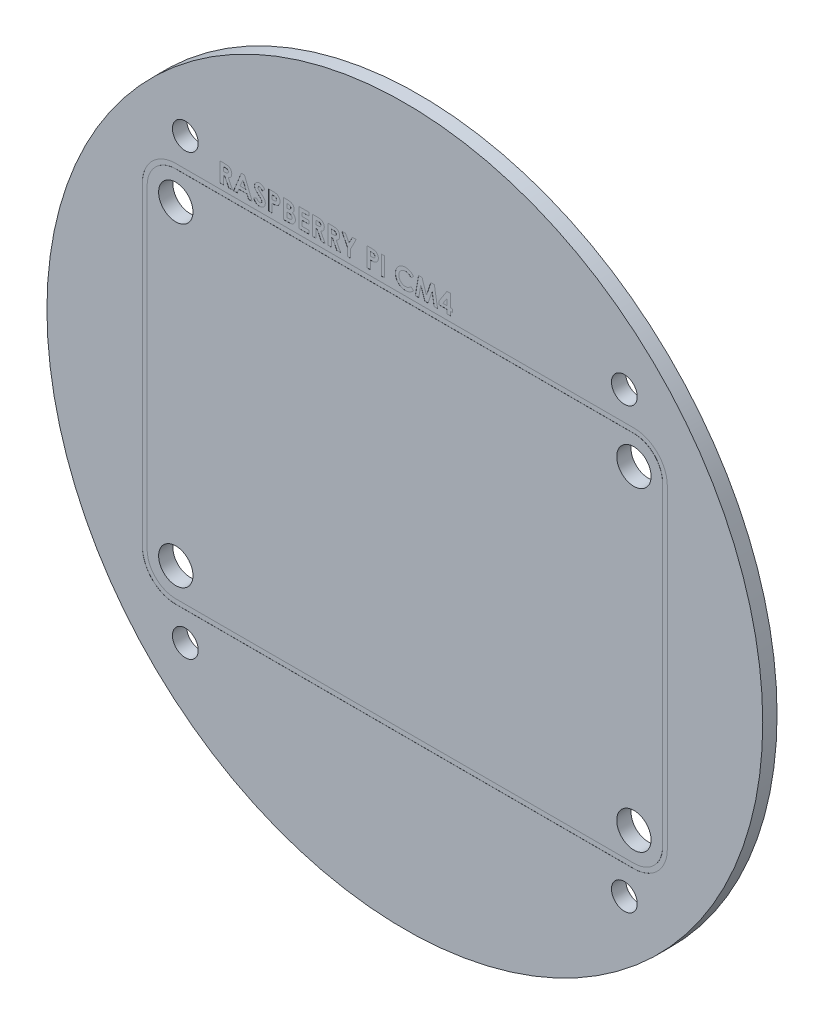
from build123d import *

# Parameters (mm, degrees)
ESQUISSE1_R             = 37.5
BOSS_EXTRU_1_DEPTH      = 1.5
D_GAGEMENT_M2_51_D      = 2.7
D_GAGEMENT_M31_D        = 3.6
ENL_V_MAT_EXTRU_1_DEPTH = 0.01
ESQUISSE7_W             = 0.358974359
ESQUISSE7_H             = 2
ENL_V_MAT_EXTRU_2_DEPTH = 0.01


with BuildPart() as part:
    # Esquisse1 → Boss.-Extru.1 (new body)
    with BuildSketch(Plane.XY):
        Circle(ESQUISSE1_R)
    extrude(amount=BOSS_EXTRU_1_DEPTH)

    # Dégagement M2.51 (through all)
    with Locations(Plane.XY.offset(1.5)):
        with Locations((-23, 23), (23, 23), (23, -23), (-23, -23)):
            Hole(D_GAGEMENT_M2_51_D / 2)

    # Dégagement M31 (through all)
    with Locations(Plane.XY.offset(1.5)):
        with Locations((-24, 16.5), (24, 16.5), (24, -16.5), (-24, -16.5)):
            Hole(D_GAGEMENT_M31_D / 2)

    # Esquisse6 → Enlèv. mat.-Extru.1 (cut)
    with BuildSketch(Plane.XY.offset(1.5)):
        with BuildLine():
            Line((-27.5, 16.5), (-27.5, -16.5))
            ThreePointArc((-27.5, -16.5), (-26.474873734, -18.974873734), (-24, -20))
            Line((-24, -20), (24, -20))
            ThreePointArc((24, -20), (26.474873734, -18.974873734), (27.5, -16.5))
            Line((27.5, -16.5), (27.5, 16.5))
            ThreePointArc((27.5, 16.5), (26.474873734, 18.974873734), (24, 20))
            Line((24, 20), (-24, 20))
            ThreePointArc((-24, 20), (-26.474873734, 18.974873734), (-27.5, 16.5))
        make_face()
        with BuildLine():
            Line((-24, 19.5), (24, 19.5))
            ThreePointArc((24, 19.5), (26.121320344, 18.621320344), (27, 16.5))
            Line((27, 16.5), (27, -16.5))
            ThreePointArc((27, -16.5), (26.121320344, -18.621320344), (24, -19.5))
            Line((24, -19.5), (-24, -19.5))
            ThreePointArc((-24, -19.5), (-26.121320344, -18.621320344), (-27, -16.5))
            Line((-27, -16.5), (-27, 16.5))
            ThreePointArc((-27, 16.5), (-26.121320344, 18.621320344), (-24, 19.5))
        make_face(mode=Mode.SUBTRACT)
    extrude(amount=-ENL_V_MAT_EXTRU_1_DEPTH, mode=Mode.SUBTRACT)

    # Esquisse7 → Enlèv. mat.-Extru.2 (cut)
    # profile 1 of 14: a face of its own
    with BuildSketch(Plane.XY.offset(1.5)):
        with BuildLine():
            Line((-19.36550309, 22.554763031), (-18.947233859, 22.554763031))
            add(Edge.make_bspline(
                [(-18.947233859, 22.554763031), (-18.91958639, 22.554664898), (-18.86641252, 22.554476162), (-18.789738703, 22.551498396), (-18.719303258, 22.547354591), (-18.655001898, 22.541031034), (-18.596862133, 22.532646763), (-18.544825694, 22.522763094), (-18.498894101, 22.511498534), (-18.458679984, 22.497462003), (-18.422388732, 22.48162901), (-18.38856024, 22.46343661), (-18.356448201, 22.443087382), (-18.326267249, 22.420045883), (-18.297755104, 22.394726623), (-18.270857977, 22.367104116), (-18.245955949, 22.336944135), (-18.223203215, 22.304437252), (-18.202465929, 22.270240757), (-18.184138518, 22.234307697), (-18.169234636, 22.196613084), (-18.156065459, 22.157701686), (-18.146580128, 22.117017256), (-18.139983218, 22.074955866), (-18.135153219, 22.031369454), (-18.134875518, 22.001758781), (-18.134733859, 21.986654057)],
                knots=[0, 0, 0, 0, 1.749336639, 3.364467119, 4.854658419, 6.213483162, 7.451590619, 8.570285859, 9.5643256, 10.440900261, 11.26203566, 12.067320669, 12.869050712, 13.665104639, 14.467235401, 15.27997916, 16.102287765, 16.939272006, 17.78853747, 18.631303466, 19.488103222, 20.351255419, 21.228522269, 22.127379805, 23.044756219, 24, 24, 24, 24], degree=3))
            add(Edge.make_bspline(
                [(-18.134733859, 21.986654057), (-18.135101837, 21.970888195), (-18.135823376, 21.939974213), (-18.139709975, 21.894564094), (-18.146813457, 21.85111887), (-18.157572715, 21.80976574), (-18.169939084, 21.769990019), (-18.186383182, 21.732525592), (-18.204941973, 21.696827595), (-18.226983706, 21.663400987), (-18.251173432, 21.631503299), (-18.279305573, 21.602356649), (-18.309557601, 21.574394513), (-18.343630091, 21.549368347), (-18.380021096, 21.525585971), (-18.419453668, 21.504032804), (-18.461670455, 21.484167051), (-18.491350948, 21.473088534), (-18.506528731, 21.467423287)],
                knots=[0, 0, 0, 0, 1.099860209, 2.156625411, 3.176576793, 4.16617041, 5.135385252, 6.078461593, 7.016046972, 7.938469504, 8.868247731, 9.803980173, 10.76021508, 11.73834243, 12.748633912, 13.790971185, 14.870363756, 16, 16, 16, 16], degree=3))
            Line((-18.506528731, 21.467423287), (-18.044990269, 20.554763031))
            Line((-18.044990269, 20.554763031), (-18.444028731, 20.554763031))
            Line((-18.444028731, 20.554763031), (-18.884733859, 21.426557903))
            Line((-18.884733859, 21.426557903), (-19.006528731, 21.426557903))
            Line((-19.006528731, 21.426557903), (-19.006528731, 20.554763031))
            Line((-19.006528731, 20.554763031), (-19.36550309, 20.554763031))
            Line((-19.36550309, 20.554763031), (-19.36550309, 22.554763031))
        make_face()
        with BuildLine():
            Line((-19.006528731, 21.785532262), (-18.866705013, 21.785532262))
            add(Edge.make_bspline(
                [(-18.866705013, 21.785532262), (-18.849610401, 21.785724793), (-18.816877893, 21.786093448), (-18.769804246, 21.787803425), (-18.727050149, 21.791923625), (-18.688432, 21.797129344), (-18.653755477, 21.803140097), (-18.623329881, 21.811753872), (-18.596686402, 21.82098375), (-18.574140764, 21.832454094), (-18.554878289, 21.845498363), (-18.538246375, 21.860316977), (-18.524489397, 21.877467636), (-18.513166703, 21.896484258), (-18.504358878, 21.917535042), (-18.49792984, 21.940388897), (-18.494336959, 21.965306158), (-18.493923586, 21.982502461), (-18.493708218, 21.991461749)],
                knots=[0, 0, 0, 0, 1.688639943, 3.233382647, 4.650958383, 5.928841754, 7.082724185, 8.122798841, 9.049171256, 9.863274652, 10.613301712, 11.341792392, 12.054588806, 12.776240173, 13.521029143, 14.301969904, 15.115324896, 16, 16, 16, 16], degree=3))
            add(Edge.make_bspline(
                [(-18.493708218, 21.991461749), (-18.49411539, 22.002061241), (-18.494915205, 22.022881979), (-18.502851855, 22.052856541), (-18.515485288, 22.080600049), (-18.532802263, 22.105987151), (-18.554610743, 22.128243237), (-18.579637694, 22.147862154), (-18.608423258, 22.163375326), (-18.635076524, 22.173607649), (-18.659324766, 22.179729753), (-18.68120804, 22.184291891), (-18.706549002, 22.187525209), (-18.735366785, 22.190954719), (-18.76758793, 22.193178582), (-18.803388062, 22.194801559), (-18.842664364, 22.195465598), (-18.870043676, 22.19567788), (-18.884333218, 22.195788672)],
                knots=[0, 0, 0, 0, 1.020303359, 2.004196876, 2.966617323, 3.9489082, 4.950758222, 5.960522915, 7.003732012, 8.091992268, 8.70421221, 9.413913587, 10.24622431, 11.166358409, 12.212345909, 13.359657661, 14.621978493, 16, 16, 16, 16], degree=3))
            Line((-18.884333218, 22.195788672), (-19.006528731, 22.195788672))
            Line((-19.006528731, 22.195788672), (-19.006528731, 21.785532262))
        make_face(mode=Mode.SUBTRACT)
    # profile 2 of 14: a face of its own
    with BuildSketch(Plane.XY.offset(1.5)):
        Polygon((-17.134333218, 22.554763031), (-16.801400526, 22.554763031), (-15.993708218, 20.554763031), (-16.377121679, 20.554763031), (-16.532570397, 20.965019441), (-17.403964628, 20.965019441), (-17.559413346, 20.554763031), (-17.942426167, 20.554763031), align=None)
        Polygon((-16.968067192, 22.018304698), (-17.267746679, 21.3239938), (-16.668387705, 21.3239938), align=None, mode=Mode.SUBTRACT)
    # profile 3 of 14: a face of its own
    with BuildSketch(Plane.XY.offset(1.5)):
        with BuildLine():
            Line((-14.673195397, 22.287535467), (-14.941624885, 22.041942518))
            add(Edge.make_bspline(
                [(-14.941624885, 22.041942518), (-14.953123253, 22.058162162), (-14.975198516, 22.089301616), (-15.010980216, 22.130998079), (-15.046600343, 22.166568265), (-15.082388896, 22.195863578), (-15.118663091, 22.218706028), (-15.155359962, 22.234878734), (-15.192271463, 22.245159877), (-15.217070294, 22.246440127), (-15.229285141, 22.247070723)],
                knots=[0, 0, 0, 0, 1.299362458, 2.494594718, 3.587462134, 4.587049575, 5.512617175, 6.380583204, 7.202344345, 8, 8, 8, 8], degree=3))
            add(Edge.make_bspline(
                [(-15.229285141, 22.247070723), (-15.2406788, 22.246671149), (-15.262676961, 22.245899675), (-15.294036972, 22.238231281), (-15.321878836, 22.22499676), (-15.346175382, 22.20769151), (-15.36542183, 22.186842695), (-15.380788627, 22.16497765), (-15.389441425, 22.140843584), (-15.390580303, 22.124267335), (-15.391144115, 22.116061108)],
                knots=[0, 0, 0, 0, 1.185010067, 2.2879431, 3.333075148, 4.379039566, 5.372662701, 6.27520591, 7.14612461, 8, 8, 8, 8], degree=3))
            add(Edge.make_bspline(
                [(-15.391144115, 22.116061108), (-15.390790803, 22.107736544), (-15.39007928, 22.090972028), (-15.383206941, 22.066401542), (-15.372848363, 22.042393318), (-15.362950319, 22.027778369), (-15.35789091, 22.020307903)],
                knots=[0, 0, 0, 0, 0.967525499, 1.948461899, 2.951351359, 4, 4, 4, 4], degree=3))
            add(Edge.make_bspline(
                [(-15.35789091, 22.020307903), (-15.35329136, 22.014501188), (-15.342703803, 22.001134896), (-15.322515501, 21.979964774), (-15.297163233, 21.954029521), (-15.265671391, 21.924220974), (-15.229347288, 21.889467103), (-15.186507254, 21.851134095), (-15.138384414, 21.80803482), (-15.104179813, 21.778022046), (-15.086256295, 21.762295082)],
                knots=[0, 0, 0, 0, 0.473873513, 1.090794244, 1.870441696, 2.795289791, 3.865433203, 5.087734844, 6.473946851, 8, 8, 8, 8], degree=3))
            add(Edge.make_bspline(
                [(-15.086256295, 21.762295082), (-15.069432495, 21.747734932), (-15.037504417, 21.720102791), (-14.992077103, 21.680883404), (-14.952154059, 21.645598678), (-14.917153699, 21.61477816), (-14.887606594, 21.588098474), (-14.863388527, 21.565432091), (-14.844203715, 21.547220283), (-14.833298273, 21.53622034), (-14.828644115, 21.531525852)],
                knots=[0, 0, 0, 0, 1.543621617, 2.929473131, 4.163658386, 5.240097082, 6.164993805, 6.925417477, 7.541396219, 8, 8, 8, 8], degree=3))
            add(Edge.make_bspline(
                [(-14.828644115, 21.531525852), (-14.81098721, 21.512417298), (-14.777044437, 21.475683948), (-14.732930798, 21.418758809), (-14.696623845, 21.363188265), (-14.668536099, 21.307926667), (-14.647323103, 21.252176701), (-14.63236766, 21.194571101), (-14.623410745, 21.134507925), (-14.622416319, 21.093522139), (-14.621913346, 21.072791877)],
                knots=[0, 0, 0, 0, 1.206664779, 2.319633467, 3.337109185, 4.282041471, 5.190008762, 6.099243693, 7.03861361, 8, 8, 8, 8], degree=3))
            add(Edge.make_bspline(
                [(-14.621913346, 21.072791877), (-14.622271349, 21.052592779), (-14.622973764, 21.012961397), (-14.631577003, 20.954966773), (-14.643844716, 20.899463401), (-14.662812753, 20.847055235), (-14.685930884, 20.796882013), (-14.714912801, 20.749725273), (-14.748948088, 20.705107769), (-14.787957752, 20.663827095), (-14.831107073, 20.626367744), (-14.877388821, 20.593020545), (-14.927255561, 20.565488185), (-14.980281241, 20.54281725), (-15.036437477, 20.525355793), (-15.095657369, 20.512450149), (-15.1580315, 20.504704385), (-15.200683829, 20.503894657), (-15.222474244, 20.50348098)],
                knots=[0, 0, 0, 0, 1.043214005, 2.046824704, 3.02475056, 3.976699089, 4.921714032, 5.875962561, 6.831408892, 7.817874052, 8.806269674, 9.781291748, 10.760897367, 11.74438705, 12.757449933, 13.795994037, 14.874007457, 16, 16, 16, 16], degree=3))
            add(Edge.make_bspline(
                [(-15.222474244, 20.50348098), (-15.239579534, 20.503784439), (-15.273457818, 20.504385462), (-15.323389287, 20.509292318), (-15.371603766, 20.51721146), (-15.418046943, 20.528561957), (-15.462928055, 20.542944575), (-15.506248944, 20.560512393), (-15.547710552, 20.581537704), (-15.587626597, 20.605588145), (-15.625803038, 20.633513875), (-15.662722601, 20.664743962), (-15.698018566, 20.699758738), (-15.731860451, 20.738475394), (-15.764031728, 20.781003568), (-15.795585478, 20.826750975), (-15.825119357, 20.876566626), (-15.843363747, 20.911512707), (-15.852682577, 20.92936239)],
                knots=[0, 0, 0, 0, 1.016823716, 2.013894106, 2.979844003, 3.91962641, 4.853723003, 5.779685073, 6.695824784, 7.614987388, 8.547259901, 9.504950863, 10.487499108, 11.500346958, 12.559593716, 13.656357062, 14.802919212, 16, 16, 16, 16], degree=3))
            Line((-15.852682577, 20.92936239), (-15.536977449, 21.118865595))
            add(Edge.make_bspline(
                [(-15.536977449, 21.118865595), (-15.525320985, 21.098603873), (-15.502974549, 21.05976042), (-15.465106424, 21.007569318), (-15.426312463, 20.962876278), (-15.385695784, 20.926471253), (-15.343750272, 20.89786746), (-15.300273319, 20.877425206), (-15.25523438, 20.864771473), (-15.2245559, 20.86322616), (-15.20925309, 20.862455339)],
                knots=[0, 0, 0, 0, 1.283663364, 2.460892379, 3.537111102, 4.529833553, 5.449777664, 6.316464042, 7.160231139, 8, 8, 8, 8], degree=3))
            add(Edge.make_bspline(
                [(-15.20925309, 20.862455339), (-15.193687941, 20.863084833), (-15.163489284, 20.864306145), (-15.120384567, 20.875587029), (-15.08086453, 20.893298844), (-15.046703702, 20.918571163), (-15.017778466, 20.947739259), (-14.996429982, 20.9801901), (-14.983018721, 21.015301127), (-14.981600825, 21.039691556), (-14.980887705, 21.051958544)],
                knots=[0, 0, 0, 0, 1.13588714, 2.203786484, 3.234766741, 4.283437687, 5.291419208, 6.222934724, 7.106237994, 8, 8, 8, 8], degree=3))
            add(Edge.make_bspline(
                [(-14.980887705, 21.051958544), (-14.981546242, 21.06337098), (-14.982883998, 21.086554252), (-14.992737493, 21.121024048), (-15.00814151, 21.155478169), (-15.02636555, 21.183738371), (-15.044910792, 21.207399872), (-15.062644226, 21.227901492), (-15.084238858, 21.250552194), (-15.109639932, 21.275380469), (-15.138511836, 21.302604887), (-15.170878889, 21.332222783), (-15.207111728, 21.363973258), (-15.232721171, 21.385601368), (-15.246112064, 21.396910467)],
                knots=[0, 0, 0, 0, 0.916159276, 1.861089862, 2.860218735, 3.940849679, 4.552606315, 5.27541173, 6.11797699, 7.06649574, 8.129236253, 9.306560635, 10.591630461, 12, 12, 12, 12], degree=3))
            add(Edge.make_bspline(
                [(-15.246112064, 21.396910467), (-15.271568685, 21.418449209), (-15.320427645, 21.459788575), (-15.389471555, 21.520845517), (-15.4516863, 21.577908824), (-15.506534527, 21.631683922), (-15.554715086, 21.681177712), (-15.595901679, 21.7267922), (-15.629641852, 21.768879239), (-15.665146108, 21.81872852), (-15.69888225, 21.879473295), (-15.728039851, 21.952556301), (-15.746956071, 22.025630034), (-15.749075371, 22.074687713), (-15.750118474, 22.098833544)],
                knots=[0, 0, 0, 0, 1.345494975, 2.582412109, 3.71882943, 4.751509156, 5.681369928, 6.505683931, 7.230279997, 7.856715994, 8.973648664, 10.023341002, 11.027102913, 12, 12, 12, 12], degree=3))
            add(Edge.make_bspline(
                [(-15.750118474, 22.098833544), (-15.749684649, 22.115956471), (-15.748829966, 22.149690477), (-15.741206065, 22.199291417), (-15.729811854, 22.247152156), (-15.713264188, 22.293098078), (-15.691787317, 22.337071631), (-15.66570449, 22.379288087), (-15.634610692, 22.419358893), (-15.59957008, 22.457257486), (-15.560964298, 22.491892488), (-15.519709113, 22.522461347), (-15.476038034, 22.54828025), (-15.430218219, 22.569698904), (-15.38196574, 22.586093524), (-15.331636073, 22.597714847), (-15.279157027, 22.60462684), (-15.243461913, 22.605566445), (-15.225278731, 22.606045082)],
                knots=[0, 0, 0, 0, 1.010766082, 1.991317756, 2.957454644, 3.913069143, 4.869106762, 5.843196583, 6.838735724, 7.860187025, 8.887984031, 9.89767229, 10.887916223, 11.879572884, 12.879850636, 13.892031539, 14.926195476, 16, 16, 16, 16], degree=3))
            add(Edge.make_bspline(
                [(-15.225278731, 22.606045082), (-15.201714226, 22.605183043), (-15.154771228, 22.603465768), (-15.08536465, 22.590037239), (-15.017571207, 22.568919463), (-14.96294198, 22.54344319), (-14.919474524, 22.518764312), (-14.886160779, 22.49604311), (-14.85226225, 22.470014752), (-14.817505568, 22.440597216), (-14.782536564, 22.407236237), (-14.746360902, 22.370725998), (-14.709471521, 22.330750967), (-14.685499272, 22.30219299), (-14.673195397, 22.287535467)],
                knots=[0, 0, 0, 0, 1.282922637, 2.555718331, 3.837320111, 5.142675274, 5.830281639, 6.55870424, 7.337177975, 8.157850921, 9.037902056, 9.96903443, 10.957596896, 12, 12, 12, 12], degree=3))
        make_face()
    # profile 4 of 14: a face of its own
    with BuildSketch(Plane.XY.offset(1.5)):
        with BuildLine():
            Line((-14.262938987, 22.554763031), (-13.862297961, 22.554763031))
            add(Edge.make_bspline(
                [(-13.862297961, 22.554763031), (-13.836120597, 22.554645856), (-13.785618973, 22.5544198), (-13.712791476, 22.55167857), (-13.645604544, 22.546766119), (-13.584073614, 22.540695106), (-13.528223985, 22.532183783), (-13.477985717, 22.522426217), (-13.433348384, 22.510538662), (-13.393808633, 22.496428299), (-13.358322985, 22.479792732), (-13.324742116, 22.462074666), (-13.293824958, 22.440928779), (-13.264011029, 22.418634085), (-13.237004843, 22.393060781), (-13.211121592, 22.365910806), (-13.187457502, 22.336107416), (-13.165902923, 22.304011372), (-13.146349598, 22.270215672), (-13.129266505, 22.2346599), (-13.115409657, 22.197287791), (-13.103785485, 22.158341102), (-13.094448836, 22.117821529), (-13.088234066, 22.075479873), (-13.084012681, 22.03161178), (-13.083640202, 22.001755129), (-13.083451808, 21.986654057)],
                knots=[0, 0, 0, 0, 1.698747864, 3.27724071, 4.728299578, 6.070144658, 7.288476769, 8.393259625, 9.389771311, 10.283485332, 11.113357557, 11.931608583, 12.74405601, 13.541433047, 14.344816069, 15.154114104, 15.974336324, 16.810834471, 17.661136416, 18.50621059, 19.367396281, 20.244825668, 21.142564693, 22.063065223, 23.020325768, 24, 24, 24, 24], degree=3))
            add(Edge.make_bspline(
                [(-13.083451808, 21.986654057), (-13.083724391, 21.9699481), (-13.084260051, 21.937118842), (-13.089511243, 21.888995178), (-13.098481938, 21.843113621), (-13.110206168, 21.799087244), (-13.126554772, 21.757640379), (-13.145232285, 21.71778409), (-13.16821155, 21.680635826), (-13.194469034, 21.645730906), (-13.223145202, 21.612785538), (-13.254920825, 21.582750956), (-13.289190246, 21.555422415), (-13.325755092, 21.530513511), (-13.364752638, 21.50807449), (-13.406154745, 21.487895235), (-13.450244131, 21.470621141), (-13.480946652, 21.461586929), (-13.496512705, 21.457006621)],
                knots=[0, 0, 0, 0, 1.102006807, 2.165578795, 3.188629044, 4.184801286, 5.166646146, 6.124351954, 7.085497154, 8.042432466, 9.003981491, 9.963833307, 10.922997304, 11.89326795, 12.880200226, 13.889073926, 14.929769137, 16, 16, 16, 16], degree=3))
            add(Edge.make_bspline(
                [(-13.496512705, 21.457006621), (-13.506765403, 21.454455733), (-13.528976047, 21.448929689), (-13.565728564, 21.443319367), (-13.60808198, 21.438161021), (-13.656173253, 21.433728047), (-13.710030108, 21.430714657), (-13.769600397, 21.428361334), (-13.834911117, 21.426650225), (-13.880325609, 21.426589507), (-13.903964628, 21.426557903)],
                knots=[0, 0, 0, 0, 0.618981996, 1.340914327, 2.176866532, 3.120127938, 4.170906482, 5.338178032, 6.614476169, 8, 8, 8, 8], degree=3))
            Line((-13.903964628, 21.426557903), (-13.903964628, 20.554763031))
            Line((-13.903964628, 20.554763031), (-14.262938987, 20.554763031))
            Line((-14.262938987, 20.554763031), (-14.262938987, 22.554763031))
        make_face()
        with BuildLine():
            Line((-13.903964628, 21.785532262), (-13.776961423, 21.785532262))
            add(Edge.make_bspline(
                [(-13.776961423, 21.785532262), (-13.753851185, 21.785678799), (-13.711328003, 21.785948429), (-13.653256353, 21.789847435), (-13.606588858, 21.795802005), (-13.569720671, 21.804342235), (-13.540609744, 21.817303166), (-13.515503393, 21.832296522), (-13.493969035, 21.851255209), (-13.47532345, 21.872918753), (-13.460416867, 21.897811251), (-13.450079928, 21.925527377), (-13.443365255, 21.955484785), (-13.442745093, 21.976333158), (-13.442426167, 21.987054698)],
                knots=[0, 0, 0, 0, 1.8619151, 3.425951444, 4.686033666, 5.651700536, 6.461346321, 7.243864085, 7.999046032, 8.762387399, 9.539336099, 10.322741239, 11.137448474, 12, 12, 12, 12], degree=3))
            add(Edge.make_bspline(
                [(-13.442426167, 21.987054698), (-13.442741812, 21.996421967), (-13.443354241, 22.014596722), (-13.447853308, 22.040827402), (-13.455023528, 22.065279806), (-13.4654129, 22.087698562), (-13.478843898, 22.108045578), (-13.495219003, 22.126312836), (-13.514328089, 22.142891548), (-13.529081421, 22.151666913), (-13.536576808, 22.156125211)],
                knots=[0, 0, 0, 0, 1.102301479, 2.1387299, 3.123554645, 4.094223062, 5.036071848, 5.982632524, 6.975082478, 8, 8, 8, 8], degree=3))
            add(Edge.make_bspline(
                [(-13.536576808, 22.156125211), (-13.542925832, 22.159336094), (-13.556368019, 22.166134194), (-13.579261366, 22.174037481), (-13.605679939, 22.180704775), (-13.635802093, 22.186238564), (-13.669507662, 22.190533359), (-13.706790633, 22.193817803), (-13.74770587, 22.195138606), (-13.77615997, 22.195566007), (-13.790983859, 22.195788672)],
                knots=[0, 0, 0, 0, 0.656809284, 1.390599849, 2.23162475, 3.173112763, 4.218524733, 5.370385145, 6.63003504, 8, 8, 8, 8], degree=3))
            Line((-13.790983859, 22.195788672), (-13.903964628, 22.195788672))
            Line((-13.903964628, 22.195788672), (-13.903964628, 21.785532262))
        make_face(mode=Mode.SUBTRACT)
    # profile 5 of 14: a face of its own
    with BuildSketch(Plane.XY.offset(1.5)):
        with BuildLine():
            Line((-12.724477449, 20.554763031), (-12.724477449, 22.554763031))
            Line((-12.724477449, 22.554763031), (-12.403964628, 22.554763031))
            add(Edge.make_bspline(
                [(-12.403964628, 22.554763031), (-12.381526727, 22.554765592), (-12.338109813, 22.554770547), (-12.275470536, 22.552570861), (-12.217377898, 22.549725321), (-12.16401677, 22.546541824), (-12.115296329, 22.541056021), (-12.071290662, 22.535274585), (-12.031911845, 22.528302529), (-12.007566062, 22.522048379), (-11.996112064, 22.51910598)],
                knots=[0, 0, 0, 0, 1.311965854, 2.538629056, 3.664479157, 4.713267157, 5.663616078, 6.530575999, 7.308677837, 8, 8, 8, 8], degree=3))
            add(Edge.make_bspline(
                [(-11.996112064, 22.51910598), (-11.981071802, 22.514955673), (-11.95155798, 22.506811438), (-11.909284768, 22.490363804), (-11.869182729, 22.472081093), (-11.831300828, 22.451223939), (-11.795871674, 22.427540537), (-11.76302991, 22.40084293), (-11.73206722, 22.372202758), (-11.704083019, 22.340821828), (-11.678789912, 22.307662062), (-11.656814736, 22.272732149), (-11.637721126, 22.23656619), (-11.622441236, 22.198709062), (-11.610928126, 22.159335105), (-11.602507485, 22.118612454), (-11.59704977, 22.076412251), (-11.596534088, 22.047702074), (-11.59627232, 22.033128416)],
                knots=[0, 0, 0, 0, 1.099996261, 2.158545794, 3.195537121, 4.207578794, 5.205712374, 6.197378256, 7.190519799, 8.17788031, 9.159561366, 10.129234751, 11.085776129, 12.040971148, 13.00380137, 13.975669004, 14.972423361, 16, 16, 16, 16], degree=3))
            add(Edge.make_bspline(
                [(-11.59627232, 22.033128416), (-11.596956764, 22.014405091), (-11.598304006, 21.977550526), (-11.606910283, 21.923417837), (-11.623048393, 21.872254666), (-11.644164717, 21.823118094), (-11.672876315, 21.776191402), (-11.709334493, 21.7314969), (-11.752948746, 21.687658379), (-11.786403286, 21.661380143), (-11.803804372, 21.647711749)],
                knots=[0, 0, 0, 0, 0.986156485, 1.941127874, 2.875419072, 3.804401753, 4.751181392, 5.761612777, 6.835722519, 8, 8, 8, 8], degree=3))
            add(Edge.make_bspline(
                [(-11.803804372, 21.647711749), (-11.789703367, 21.640513308), (-11.762055197, 21.626399158), (-11.72280292, 21.603199707), (-11.686459595, 21.578524149), (-11.652862271, 21.552868966), (-11.62271569, 21.525146598), (-11.59477505, 21.496954444), (-11.570418796, 21.466677213), (-11.5486387, 21.435394042), (-11.529707794, 21.402651947), (-11.513221062, 21.368506223), (-11.499295312, 21.33284022), (-11.487502626, 21.29583545), (-11.478707638, 21.257364632), (-11.472973118, 21.217414009), (-11.468582412, 21.176119833), (-11.468240856, 21.147991271), (-11.468067192, 21.133689313)],
                knots=[0, 0, 0, 0, 1.164658916, 2.283573913, 3.35186032, 4.395461096, 5.390182219, 6.362969632, 7.312859996, 8.245001507, 9.165155236, 10.092416118, 11.032087915, 11.979892451, 12.947605196, 13.931445124, 14.948243989, 16, 16, 16, 16], degree=3))
            add(Edge.make_bspline(
                [(-11.468067192, 21.133689313), (-11.469194155, 21.106373392), (-11.471418211, 21.052465531), (-11.487679423, 20.97331641), (-11.515871197, 20.898275865), (-11.553726937, 20.827642138), (-11.600372492, 20.76345996), (-11.654001503, 20.70723693), (-11.714074051, 20.659645383), (-11.769498236, 20.627524781), (-11.817435792, 20.605968853), (-11.857141574, 20.592641619), (-11.899784742, 20.58029529), (-11.946146417, 20.571625443), (-11.995386124, 20.563689845), (-12.047983955, 20.558790243), (-12.103841604, 20.555469903), (-12.142207052, 20.555003419), (-12.161977449, 20.554763031)],
                knots=[0, 0, 0, 0, 1.284142165, 2.534249414, 3.780121997, 5.041676246, 6.291546858, 7.49970053, 8.684500223, 9.883330709, 10.50184324, 11.153274765, 11.851151195, 12.587658647, 13.369265475, 14.195992086, 15.070362669, 16, 16, 16, 16], degree=3))
            Line((-12.161977449, 20.554763031), (-12.724477449, 20.554763031))
        make_face()
        with BuildLine():
            Line((-12.36550309, 22.195788672), (-12.36550309, 21.759891236))
            Line((-12.36550309, 21.759891236), (-12.270150526, 21.759891236))
            add(Edge.make_bspline(
                [(-12.270150526, 21.759891236), (-12.257191255, 21.760004246), (-12.232174169, 21.760222404), (-12.19603964, 21.76303221), (-12.162440365, 21.767825912), (-12.131503776, 21.774514332), (-12.10294169, 21.783007651), (-12.076936567, 21.793226943), (-12.05360275, 21.80569559), (-12.02649425, 21.82426819), (-11.997838612, 21.851598601), (-11.972613375, 21.891083044), (-11.957755879, 21.936490003), (-11.956101155, 21.968514506), (-11.955246679, 21.985051493)],
                knots=[0, 0, 0, 0, 1.065314748, 2.056525647, 2.977365736, 3.853934255, 4.656397591, 5.425096493, 6.14721249, 6.826394842, 8.123232004, 9.372140726, 10.643011755, 12, 12, 12, 12], degree=3))
            add(Edge.make_bspline(
                [(-11.955246679, 21.985051493), (-11.955930416, 22.000541128), (-11.957252394, 22.030489717), (-11.972211982, 22.072540202), (-11.99544718, 22.109805538), (-12.022879597, 22.135310613), (-12.048712547, 22.152729827), (-12.070832305, 22.164199638), (-12.0951104, 22.174467296), (-12.122016831, 22.182318197), (-12.151397946, 22.188209236), (-12.183111026, 22.1925355), (-12.217210786, 22.195480138), (-12.240763563, 22.195683622), (-12.252922961, 22.195788672)],
                knots=[0, 0, 0, 0, 1.347982417, 2.606269829, 3.849316587, 5.153353503, 5.842674298, 6.568177932, 7.326619318, 8.142485038, 9.012069166, 9.942760135, 10.937925643, 12, 12, 12, 12], degree=3))
            Line((-12.252922961, 22.195788672), (-12.36550309, 22.195788672))
        make_face(mode=Mode.SUBTRACT)
        with BuildLine():
            Line((-12.36550309, 21.426557903), (-12.36550309, 20.91373739))
            Line((-12.36550309, 20.91373739), (-12.262137705, 20.91373739))
            add(Edge.make_bspline(
                [(-12.262137705, 20.91373739), (-12.241702237, 20.913854137), (-12.202412499, 20.914078598), (-12.14613002, 20.916790618), (-12.094955176, 20.921678557), (-12.04902356, 20.927780755), (-12.008264821, 20.936048279), (-11.972816732, 20.946559376), (-11.942193169, 20.958123413), (-11.916577752, 20.972406372), (-11.895651423, 20.989028195), (-11.876767606, 21.006016097), (-11.861370918, 21.025613247), (-11.849188772, 21.046978393), (-11.838645145, 21.06958081), (-11.832285974, 21.094303115), (-11.827444325, 21.120412597), (-11.827177876, 21.138471961), (-11.827041551, 21.147711749)],
                knots=[0, 0, 0, 0, 1.753078804, 3.370512758, 4.83203934, 6.162291463, 7.344201807, 8.395507345, 9.331626367, 10.147333109, 10.898971645, 11.62040215, 12.321813352, 13.025280112, 13.727906689, 14.453419512, 15.208716525, 16, 16, 16, 16], degree=3))
            add(Edge.make_bspline(
                [(-11.827041551, 21.147711749), (-11.827342186, 21.158277592), (-11.827927741, 21.178857013), (-11.832709975, 21.208936032), (-11.841400857, 21.237016792), (-11.852347447, 21.263817355), (-11.867580208, 21.28837817), (-11.885683824, 21.311549191), (-11.907557614, 21.332545777), (-11.932155967, 21.352637879), (-11.96084751, 21.370229604), (-11.993645705, 21.385493541), (-12.030728729, 21.398241419), (-12.072211451, 21.408391288), (-12.117912014, 21.417005341), (-12.168163982, 21.422148882), (-12.222548839, 21.425974359), (-12.260260183, 21.426358968), (-12.27976591, 21.426557903)],
                knots=[0, 0, 0, 0, 0.845221588, 1.646264278, 2.427170338, 3.19324141, 3.95557735, 4.731569926, 5.540061037, 6.376114724, 7.268642756, 8.224665384, 9.265483498, 10.400594375, 11.639216012, 12.983232105, 14.439614077, 16, 16, 16, 16], degree=3))
            Line((-12.27976591, 21.426557903), (-12.36550309, 21.426557903))
        make_face(mode=Mode.SUBTRACT)
    # profile 6 of 14: a face of its own
    with BuildSketch(Plane.XY.offset(1.5)):
        Polygon((-11.109092833, 22.554763031), (-10.032169756, 22.554763031), (-10.032169756, 22.195788672), (-10.750118474, 22.195788672), (-10.750118474, 21.811173287), (-10.032169756, 21.811173287), (-10.032169756, 21.452198928), (-10.750118474, 21.452198928), (-10.750118474, 20.91373739), (-10.032169756, 20.91373739), (-10.032169756, 20.554763031), (-11.109092833, 20.554763031), align=None)
    # profile 7 of 14: a face of its own
    with BuildSketch(Plane.XY.offset(1.5)):
        with BuildLine():
            Line((-9.673195397, 22.554763031), (-9.254926167, 22.554763031))
            add(Edge.make_bspline(
                [(-9.254926167, 22.554763031), (-9.227278698, 22.554664898), (-9.174104827, 22.554476162), (-9.09743101, 22.551498396), (-9.026995565, 22.547354591), (-8.962694206, 22.541031034), (-8.904554441, 22.532646763), (-8.852518002, 22.522763094), (-8.806586408, 22.511498534), (-8.766372292, 22.497462003), (-8.73008104, 22.48162901), (-8.696252548, 22.46343661), (-8.664140509, 22.443087382), (-8.633959556, 22.420045883), (-8.605447412, 22.394726623), (-8.578550285, 22.367104116), (-8.553648257, 22.336944135), (-8.530895523, 22.304437252), (-8.510158237, 22.270240757), (-8.491830825, 22.234307697), (-8.476926944, 22.196613084), (-8.463757767, 22.157701686), (-8.454272435, 22.117017256), (-8.447675526, 22.074955866), (-8.442845527, 22.031369454), (-8.442567825, 22.001758781), (-8.442426167, 21.986654057)],
                knots=[0, 0, 0, 0, 1.749336639, 3.364467119, 4.854658419, 6.213483162, 7.451590619, 8.570285859, 9.5643256, 10.440900261, 11.26203566, 12.067320669, 12.869050712, 13.665104639, 14.467235401, 15.27997916, 16.102287765, 16.939272006, 17.78853747, 18.631303466, 19.488103222, 20.351255419, 21.228522269, 22.127379805, 23.044756219, 24, 24, 24, 24], degree=3))
            add(Edge.make_bspline(
                [(-8.442426167, 21.986654057), (-8.442794145, 21.970888195), (-8.443515684, 21.939974213), (-8.447402283, 21.894564094), (-8.454505765, 21.85111887), (-8.465265023, 21.80976574), (-8.477631392, 21.769990019), (-8.49407549, 21.732525592), (-8.512634281, 21.696827595), (-8.534676014, 21.663400987), (-8.558865739, 21.631503299), (-8.586997881, 21.602356649), (-8.617249909, 21.574394513), (-8.651322399, 21.549368347), (-8.687713404, 21.525585971), (-8.727145976, 21.504032804), (-8.769362763, 21.484167051), (-8.799043255, 21.473088534), (-8.814221038, 21.467423287)],
                knots=[0, 0, 0, 0, 1.099860209, 2.156625411, 3.176576793, 4.16617041, 5.135385252, 6.078461593, 7.016046972, 7.938469504, 8.868247731, 9.803980173, 10.76021508, 11.73834243, 12.748633912, 13.790971185, 14.870363756, 16, 16, 16, 16], degree=3))
            Line((-8.814221038, 21.467423287), (-8.352682577, 20.554763031))
            Line((-8.352682577, 20.554763031), (-8.751721038, 20.554763031))
            Line((-8.751721038, 20.554763031), (-9.192426167, 21.426557903))
            Line((-9.192426167, 21.426557903), (-9.314221038, 21.426557903))
            Line((-9.314221038, 21.426557903), (-9.314221038, 20.554763031))
            Line((-9.314221038, 20.554763031), (-9.673195397, 20.554763031))
            Line((-9.673195397, 20.554763031), (-9.673195397, 22.554763031))
        make_face()
        with BuildLine():
            Line((-9.314221038, 21.785532262), (-9.17439732, 21.785532262))
            add(Edge.make_bspline(
                [(-9.17439732, 21.785532262), (-9.157302709, 21.785724793), (-9.1245702, 21.786093448), (-9.077496554, 21.787803425), (-9.034742457, 21.791923625), (-8.996124308, 21.797129344), (-8.961447785, 21.803140097), (-8.931022189, 21.811753872), (-8.904378709, 21.82098375), (-8.881833072, 21.832454094), (-8.862570597, 21.845498363), (-8.845938683, 21.860316977), (-8.832181705, 21.877467636), (-8.820859011, 21.896484258), (-8.812051186, 21.917535042), (-8.805622148, 21.940388897), (-8.802029267, 21.965306158), (-8.801615893, 21.982502461), (-8.801400526, 21.991461749)],
                knots=[0, 0, 0, 0, 1.688639943, 3.233382647, 4.650958383, 5.928841754, 7.082724185, 8.122798841, 9.049171256, 9.863274652, 10.613301712, 11.341792392, 12.054588806, 12.776240173, 13.521029143, 14.301969904, 15.115324896, 16, 16, 16, 16], degree=3))
            add(Edge.make_bspline(
                [(-8.801400526, 21.991461749), (-8.801807698, 22.002061241), (-8.802607513, 22.022881979), (-8.810544163, 22.052856541), (-8.823177596, 22.080600049), (-8.840494571, 22.105987151), (-8.862303051, 22.128243237), (-8.887330001, 22.147862154), (-8.916115565, 22.163375326), (-8.942768832, 22.173607649), (-8.967017074, 22.179729753), (-8.988900347, 22.184291891), (-9.01424131, 22.187525209), (-9.043059093, 22.190954719), (-9.075280238, 22.193178582), (-9.11108037, 22.194801559), (-9.150356672, 22.195465598), (-9.177735984, 22.19567788), (-9.192025526, 22.195788672)],
                knots=[0, 0, 0, 0, 1.020303359, 2.004196876, 2.966617323, 3.9489082, 4.950758222, 5.960522915, 7.003732012, 8.091992268, 8.70421221, 9.413913587, 10.24622431, 11.166358409, 12.212345909, 13.359657661, 14.621978493, 16, 16, 16, 16], degree=3))
            Line((-9.192025526, 22.195788672), (-9.314221038, 22.195788672))
            Line((-9.314221038, 22.195788672), (-9.314221038, 21.785532262))
        make_face(mode=Mode.SUBTRACT)
    # profile 8 of 14: a face of its own
    with BuildSketch(Plane.XY.offset(1.5)):
        with BuildLine():
            Line((-8.057810782, 22.554763031), (-7.639541551, 22.554763031))
            add(Edge.make_bspline(
                [(-7.639541551, 22.554763031), (-7.611894082, 22.554664898), (-7.558720212, 22.554476162), (-7.482046395, 22.551498396), (-7.41161095, 22.547354591), (-7.34730959, 22.541031034), (-7.289169826, 22.532646763), (-7.237133386, 22.522763094), (-7.191201793, 22.511498534), (-7.150987676, 22.497462003), (-7.114696425, 22.48162901), (-7.080867932, 22.46343661), (-7.048755893, 22.443087382), (-7.018574941, 22.420045883), (-6.990062797, 22.394726623), (-6.96316567, 22.367104116), (-6.938263642, 22.336944135), (-6.915510907, 22.304437252), (-6.894773621, 22.270240757), (-6.87644621, 22.234307697), (-6.861542328, 22.196613084), (-6.848373152, 22.157701686), (-6.83888782, 22.117017256), (-6.832290911, 22.074955866), (-6.827460912, 22.031369454), (-6.82718321, 22.001758781), (-6.827041551, 21.986654057)],
                knots=[0, 0, 0, 0, 1.749336639, 3.364467119, 4.854658419, 6.213483162, 7.451590619, 8.570285859, 9.5643256, 10.440900261, 11.26203566, 12.067320669, 12.869050712, 13.665104639, 14.467235401, 15.27997916, 16.102287765, 16.939272006, 17.78853747, 18.631303466, 19.488103222, 20.351255419, 21.228522269, 22.127379805, 23.044756219, 24, 24, 24, 24], degree=3))
            add(Edge.make_bspline(
                [(-6.827041551, 21.986654057), (-6.82740953, 21.970888195), (-6.828131068, 21.939974213), (-6.832017667, 21.894564094), (-6.83912115, 21.85111887), (-6.849880407, 21.80976574), (-6.862246776, 21.769990019), (-6.878690875, 21.732525592), (-6.897249665, 21.696827595), (-6.919291398, 21.663400987), (-6.943481124, 21.631503299), (-6.971613266, 21.602356649), (-7.001865293, 21.574394513), (-7.035937783, 21.549368347), (-7.072328789, 21.525585971), (-7.11176136, 21.504032804), (-7.153978148, 21.484167051), (-7.18365864, 21.473088534), (-7.198836423, 21.467423287)],
                knots=[0, 0, 0, 0, 1.099860209, 2.156625411, 3.176576793, 4.16617041, 5.135385252, 6.078461593, 7.016046972, 7.938469504, 8.868247731, 9.803980173, 10.76021508, 11.73834243, 12.748633912, 13.790971185, 14.870363756, 16, 16, 16, 16], degree=3))
            Line((-7.198836423, 21.467423287), (-6.737297961, 20.554763031))
            Line((-6.737297961, 20.554763031), (-7.136336423, 20.554763031))
            Line((-7.136336423, 20.554763031), (-7.577041551, 21.426557903))
            Line((-7.577041551, 21.426557903), (-7.698836423, 21.426557903))
            Line((-7.698836423, 21.426557903), (-7.698836423, 20.554763031))
            Line((-7.698836423, 20.554763031), (-8.057810782, 20.554763031))
            Line((-8.057810782, 20.554763031), (-8.057810782, 22.554763031))
        make_face()
        with BuildLine():
            Line((-7.698836423, 21.785532262), (-7.559012705, 21.785532262))
            add(Edge.make_bspline(
                [(-7.559012705, 21.785532262), (-7.541918093, 21.785724793), (-7.509185585, 21.786093448), (-7.462111939, 21.787803425), (-7.419357841, 21.791923625), (-7.380739693, 21.797129344), (-7.346063169, 21.803140097), (-7.315637574, 21.811753872), (-7.288994094, 21.82098375), (-7.266448456, 21.832454094), (-7.247185981, 21.845498363), (-7.230554067, 21.860316977), (-7.21679709, 21.877467636), (-7.205474395, 21.896484258), (-7.19666657, 21.917535042), (-7.190237533, 21.940388897), (-7.186644651, 21.965306158), (-7.186231278, 21.982502461), (-7.18601591, 21.991461749)],
                knots=[0, 0, 0, 0, 1.688639943, 3.233382647, 4.650958383, 5.928841754, 7.082724185, 8.122798841, 9.049171256, 9.863274652, 10.613301712, 11.341792392, 12.054588806, 12.776240173, 13.521029143, 14.301969904, 15.115324896, 16, 16, 16, 16], degree=3))
            add(Edge.make_bspline(
                [(-7.18601591, 21.991461749), (-7.186423083, 22.002061241), (-7.187222898, 22.022881979), (-7.195159548, 22.052856541), (-7.20779298, 22.080600049), (-7.225109956, 22.105987151), (-7.246918435, 22.128243237), (-7.271945386, 22.147862154), (-7.30073095, 22.163375326), (-7.327384216, 22.173607649), (-7.351632458, 22.179729753), (-7.373515732, 22.184291891), (-7.398856695, 22.187525209), (-7.427674477, 22.190954719), (-7.459895623, 22.193178582), (-7.495695755, 22.194801559), (-7.534972056, 22.195465598), (-7.562351369, 22.19567788), (-7.57664091, 22.195788672)],
                knots=[0, 0, 0, 0, 1.020303359, 2.004196876, 2.966617323, 3.9489082, 4.950758222, 5.960522915, 7.003732012, 8.091992268, 8.70421221, 9.413913587, 10.24622431, 11.166358409, 12.212345909, 13.359657661, 14.621978493, 16, 16, 16, 16], degree=3))
            Line((-7.57664091, 22.195788672), (-7.698836423, 22.195788672))
            Line((-7.698836423, 22.195788672), (-7.698836423, 21.785532262))
        make_face(mode=Mode.SUBTRACT)
    # profile 9 of 14: a face of its own
    with BuildSketch(Plane.XY.offset(1.5)):
        Polygon((-6.609092833, 22.554763031), (-6.209653731, 22.554763031), (-5.852682577, 21.853240595), (-5.495711423, 22.554763031), (-5.09627232, 22.554763031), (-5.673195397, 21.420948928), (-5.673195397, 20.554763031), (-6.032169756, 20.554763031), (-6.032169756, 21.420948928), align=None)
    # profile 10 of 14: a face of its own
    with BuildSketch(Plane.XY.offset(1.5)):
        with BuildLine():
            Line((-3.955246679, 22.554763031), (-3.554605654, 22.554763031))
            add(Edge.make_bspline(
                [(-3.554605654, 22.554763031), (-3.528428289, 22.554645856), (-3.477926665, 22.5544198), (-3.405099168, 22.55167857), (-3.337912237, 22.546766119), (-3.276381306, 22.540695106), (-3.220531677, 22.532183783), (-3.170293409, 22.522426217), (-3.125656076, 22.510538662), (-3.086116326, 22.496428299), (-3.050630677, 22.479792732), (-3.017049808, 22.462074666), (-2.98613265, 22.440928779), (-2.956318722, 22.418634085), (-2.929312535, 22.393060781), (-2.903429284, 22.365910806), (-2.879765194, 22.336107416), (-2.858210615, 22.304011372), (-2.83865729, 22.270215672), (-2.821574198, 22.2346599), (-2.80771735, 22.197287791), (-2.796093177, 22.158341102), (-2.786756529, 22.117821529), (-2.780541758, 22.075479873), (-2.776320373, 22.03161178), (-2.775947895, 22.001755129), (-2.7757595, 21.986654057)],
                knots=[0, 0, 0, 0, 1.698747864, 3.27724071, 4.728299578, 6.070144658, 7.288476769, 8.393259625, 9.389771311, 10.283485332, 11.113357557, 11.931608583, 12.74405601, 13.541433047, 14.344816069, 15.154114104, 15.974336324, 16.810834471, 17.661136416, 18.50621059, 19.367396281, 20.244825668, 21.142564693, 22.063065223, 23.020325768, 24, 24, 24, 24], degree=3))
            add(Edge.make_bspline(
                [(-2.7757595, 21.986654057), (-2.776032083, 21.9699481), (-2.776567743, 21.937118842), (-2.781818935, 21.888995178), (-2.790789631, 21.843113621), (-2.80251386, 21.799087244), (-2.818862465, 21.757640379), (-2.837539977, 21.71778409), (-2.860519242, 21.680635826), (-2.886776726, 21.645730906), (-2.915452894, 21.612785538), (-2.947228517, 21.582750956), (-2.981497939, 21.555422415), (-3.018062784, 21.530513511), (-3.05706033, 21.50807449), (-3.098462437, 21.487895235), (-3.142551823, 21.470621141), (-3.173254345, 21.461586929), (-3.188820397, 21.457006621)],
                knots=[0, 0, 0, 0, 1.102006807, 2.165578795, 3.188629044, 4.184801286, 5.166646146, 6.124351954, 7.085497154, 8.042432466, 9.003981491, 9.963833307, 10.922997304, 11.89326795, 12.880200226, 13.889073926, 14.929769137, 16, 16, 16, 16], degree=3))
            add(Edge.make_bspline(
                [(-3.188820397, 21.457006621), (-3.199073095, 21.454455733), (-3.22128374, 21.448929689), (-3.258036256, 21.443319367), (-3.300389673, 21.438161021), (-3.348480945, 21.433728047), (-3.4023378, 21.430714657), (-3.461908089, 21.428361334), (-3.527218809, 21.426650225), (-3.572633301, 21.426589507), (-3.59627232, 21.426557903)],
                knots=[0, 0, 0, 0, 0.618981996, 1.340914327, 2.176866532, 3.120127938, 4.170906482, 5.338178032, 6.614476169, 8, 8, 8, 8], degree=3))
            Line((-3.59627232, 21.426557903), (-3.59627232, 20.554763031))
            Line((-3.59627232, 20.554763031), (-3.955246679, 20.554763031))
            Line((-3.955246679, 20.554763031), (-3.955246679, 22.554763031))
        make_face()
        with BuildLine():
            Line((-3.59627232, 21.785532262), (-3.469269115, 21.785532262))
            add(Edge.make_bspline(
                [(-3.469269115, 21.785532262), (-3.446158877, 21.785678799), (-3.403635695, 21.785948429), (-3.345564045, 21.789847435), (-3.29889655, 21.795802005), (-3.262028363, 21.804342235), (-3.232917437, 21.817303166), (-3.207811085, 21.832296522), (-3.186276727, 21.851255209), (-3.167631142, 21.872918753), (-3.152724559, 21.897811251), (-3.14238762, 21.925527377), (-3.135672948, 21.955484785), (-3.135052785, 21.976333158), (-3.134733859, 21.987054698)],
                knots=[0, 0, 0, 0, 1.8619151, 3.425951444, 4.686033666, 5.651700536, 6.461346321, 7.243864085, 7.999046032, 8.762387399, 9.539336099, 10.322741239, 11.137448474, 12, 12, 12, 12], degree=3))
            add(Edge.make_bspline(
                [(-3.134733859, 21.987054698), (-3.135049505, 21.996421967), (-3.135661933, 22.014596722), (-3.140161001, 22.040827402), (-3.14733122, 22.065279806), (-3.157720592, 22.087698562), (-3.17115159, 22.108045578), (-3.187526695, 22.126312836), (-3.206635782, 22.142891548), (-3.221389114, 22.151666913), (-3.2288845, 22.156125211)],
                knots=[0, 0, 0, 0, 1.102301479, 2.1387299, 3.123554645, 4.094223062, 5.036071848, 5.982632524, 6.975082478, 8, 8, 8, 8], degree=3))
            add(Edge.make_bspline(
                [(-3.2288845, 22.156125211), (-3.235233525, 22.159336094), (-3.248675711, 22.166134194), (-3.271569059, 22.174037481), (-3.297987632, 22.180704775), (-3.328109786, 22.186238564), (-3.361815355, 22.190533359), (-3.399098325, 22.193817803), (-3.440013563, 22.195138606), (-3.468467662, 22.195566007), (-3.483291551, 22.195788672)],
                knots=[0, 0, 0, 0, 0.656809284, 1.390599849, 2.23162475, 3.173112763, 4.218524733, 5.370385145, 6.63003504, 8, 8, 8, 8], degree=3))
            Line((-3.483291551, 22.195788672), (-3.59627232, 22.195788672))
            Line((-3.59627232, 22.195788672), (-3.59627232, 21.785532262))
        make_face(mode=Mode.SUBTRACT)
    # profile 11 of 14: a face of its own
    with BuildSketch(Plane.XY.offset(1.5)):
        with Locations((-2.288580013, 21.554763031)):
            Rectangle(ESQUISSE7_W, ESQUISSE7_H)
    # profile 12 of 14: a face of its own
    with BuildSketch(Plane.XY.offset(1.5)):
        with BuildLine():
            Line((0.916548192, 22.207807903), (0.653327039, 21.956205339))
            add(Edge.make_bspline(
                [(0.653327039, 21.956205339), (0.630998476, 21.97929311), (0.587383798, 22.02439076), (0.517104138, 22.084096075), (0.44401585, 22.133852377), (0.369540722, 22.175756817), (0.292339161, 22.207460513), (0.213303829, 22.23056353), (0.13193006, 22.244648566), (0.076859423, 22.246260143), (0.049160372, 22.247070723)],
                knots=[0, 0, 0, 0, 1.115251505, 2.178435587, 3.19620269, 4.182487026, 5.141301733, 6.088180966, 7.038406374, 8, 8, 8, 8], degree=3))
            add(Edge.make_bspline(
                [(0.049160372, 22.247070723), (0.026028298, 22.246430337), (-0.019620301, 22.245166604), (-0.086644407, 22.235902198), (-0.150756428, 22.220147673), (-0.21217583, 22.198435019), (-0.270721883, 22.170339997), (-0.326517337, 22.135884352), (-0.379424631, 22.095379267), (-0.428744889, 22.049034318), (-0.473861328, 21.998398978), (-0.513724575, 21.944371192), (-0.547116438, 21.887074733), (-0.574520597, 21.827089858), (-0.595867378, 21.764138927), (-0.611111661, 21.698264322), (-0.619928547, 21.629387591), (-0.621244527, 21.582565703), (-0.621913346, 21.558769441)],
                knots=[0, 0, 0, 0, 1.035432265, 2.043311493, 3.022114605, 3.98653278, 4.95457646, 5.923598177, 6.917315552, 7.932509744, 8.948865224, 9.949768934, 10.933144597, 11.912367597, 12.897413939, 13.903909035, 14.934704909, 16, 16, 16, 16], degree=3))
            add(Edge.make_bspline(
                [(-0.621913346, 21.558769441), (-0.6217206, 21.54206756), (-0.621340693, 21.50914781), (-0.617181944, 21.460450362), (-0.610485377, 21.413202325), (-0.600793785, 21.367475266), (-0.588674355, 21.32322956), (-0.574455503, 21.280083499), (-0.556618163, 21.238633266), (-0.536818446, 21.198397443), (-0.513791604, 21.160473915), (-0.488964419, 21.124310683), (-0.462043392, 21.090085017), (-0.432854151, 21.057936831), (-0.400985896, 21.028368531), (-0.367262302, 21.000490961), (-0.3311145, 20.975001992), (-0.29329337, 20.951261951), (-0.253472186, 20.930638775), (-0.212731389, 20.911958162), (-0.170453266, 20.896786726), (-0.127152579, 20.884557166), (-0.08298407, 20.87415775), (-0.037515729, 20.867754511), (0.008858291, 20.862905413), (0.040199344, 20.862606009), (0.055971269, 20.862455339)],
                knots=[0, 0, 0, 0, 1.103660481, 2.175337485, 3.227646561, 4.255952547, 5.262355991, 6.258840057, 7.255597736, 8.242457506, 9.22035537, 10.185017736, 11.140346927, 12.096287581, 13.051739095, 14.01125915, 14.986044842, 15.97314143, 16.960198552, 17.947847494, 18.933482797, 19.925264591, 20.920966487, 21.929612487, 22.958107872, 24, 24, 24, 24], degree=3))
            add(Edge.make_bspline(
                [(0.055971269, 20.862455339), (0.082723165, 20.863229146), (0.135283683, 20.864749475), (0.2124238, 20.876638233), (0.285930647, 20.896194568), (0.344662266, 20.919289462), (0.390676938, 20.942095971), (0.425707228, 20.963190868), (0.461931278, 20.986787827), (0.498747437, 21.013777422), (0.536569815, 21.043835767), (0.574730759, 21.077621196), (0.614207196, 21.114021203), (0.640067819, 21.140000604), (0.653327039, 21.153320723)],
                knots=[0, 0, 0, 0, 1.404581149, 2.759636711, 4.088442092, 5.392261763, 6.066678138, 6.783632037, 7.538459478, 8.336747902, 9.180226004, 10.074962426, 11.012997595, 12, 12, 12, 12], degree=3))
            Line((0.653327039, 21.153320723), (0.908535372, 20.885291877))
            add(Edge.make_bspline(
                [(0.908535372, 20.885291877), (0.8905956, 20.86797159), (0.855581001, 20.834166095), (0.802762451, 20.786165445), (0.750010375, 20.743031526), (0.698599154, 20.703198764), (0.647686617, 20.667827584), (0.597278165, 20.636882662), (0.547944443, 20.609581356), (0.498661021, 20.586384088), (0.44912123, 20.566687198), (0.398150608, 20.549729468), (0.345593332, 20.535383839), (0.291128405, 20.5238088), (0.235263844, 20.514527182), (0.177476831, 20.508262143), (0.118133763, 20.504050366), (0.077880441, 20.503671903), (0.057573833, 20.50348098)],
                knots=[0, 0, 0, 0, 1.244526981, 2.429050516, 3.560637417, 4.644440555, 5.67424972, 6.652764056, 7.595344123, 8.486817594, 9.369275933, 10.254498637, 11.166417451, 12.086725134, 13.032340136, 13.991389299, 14.986715468, 16, 16, 16, 16], degree=3))
            add(Edge.make_bspline(
                [(0.057573833, 20.50348098), (0.020273111, 20.50443185), (-0.052714034, 20.506292437), (-0.159674792, 20.520078134), (-0.261284641, 20.543189611), (-0.357790779, 20.575875615), (-0.449162518, 20.617630453), (-0.535376484, 20.668819923), (-0.616293718, 20.729308024), (-0.691260569, 20.798385776), (-0.759071654, 20.874676353), (-0.8190088, 20.956591504), (-0.868588809, 21.044533812), (-0.909756159, 21.137204086), (-0.941948485, 21.235025218), (-0.964606425, 21.338103021), (-0.978579412, 21.446337966), (-0.980108076, 21.520264929), (-0.980887705, 21.557968159)],
                knots=[0, 0, 0, 0, 1.078019885, 2.10938526, 3.111377082, 4.085535484, 5.04941344, 6.010039228, 6.978205633, 7.964457913, 8.951525778, 9.924444315, 10.892603023, 11.863865945, 12.85144698, 13.863884204, 14.910567087, 16, 16, 16, 16], degree=3))
            add(Edge.make_bspline(
                [(-0.980887705, 21.557968159), (-0.980558272, 21.582557885), (-0.979905415, 21.63128871), (-0.973043834, 21.703073164), (-0.963478391, 21.773050166), (-0.948303684, 21.840493124), (-0.930012073, 21.906310618), (-0.907264051, 21.969787289), (-0.880095949, 22.031105575), (-0.849383461, 22.090368127), (-0.81463873, 22.147186711), (-0.775825052, 22.201073167), (-0.733941641, 22.252443487), (-0.687982108, 22.30061615), (-0.638614305, 22.346014121), (-0.585615341, 22.388391379), (-0.52930398, 22.428355661), (-0.469527806, 22.464876387), (-0.407448113, 22.497911325), (-0.343847888, 22.527049551), (-0.278883389, 22.551402398), (-0.212829293, 22.571602186), (-0.145406522, 22.586679899), (-0.077096322, 22.598093242), (-0.007317456, 22.604473374), (0.039533008, 22.605517842), (0.063182808, 22.606045082)],
                knots=[0, 0, 0, 0, 1.071919942, 2.124283339, 3.142214191, 4.149696895, 5.136002878, 6.119640489, 7.086990633, 8.058538607, 9.028339693, 9.988281803, 10.952401235, 11.916291999, 12.888973767, 13.874849856, 14.873389453, 15.898127285, 16.927174885, 17.938320013, 18.946391617, 19.950418109, 20.947802303, 21.956882652, 22.968648068, 24, 24, 24, 24], degree=3))
            add(Edge.make_bspline(
                [(0.063182808, 22.606045082), (0.083358512, 22.605742855), (0.123500149, 22.605141542), (0.183277783, 22.600128948), (0.242577343, 22.592256719), (0.301186519, 22.580379202), (0.359524544, 22.566279088), (0.41682479, 22.547816934), (0.4739912, 22.527237383), (0.530127204, 22.502638734), (0.585311159, 22.475787085), (0.638250294, 22.445322915), (0.689833453, 22.413120954), (0.738917584, 22.377275349), (0.786422137, 22.339086287), (0.832098708, 22.298375594), (0.875546459, 22.254464503), (0.902811854, 22.223438726), (0.916548192, 22.207807903)],
                knots=[0, 0, 0, 0, 0.996412454, 1.982464992, 2.961075852, 3.949442424, 4.934965278, 5.923860011, 6.921385422, 7.934793307, 8.949617135, 9.951082467, 10.950285876, 11.951772932, 12.951063433, 13.960125323, 14.972308753, 16, 16, 16, 16], degree=3))
        make_face()
    # profile 13 of 14: a face of its own
    with BuildSketch(Plane.XY.offset(1.5)):
        Polygon((1.433775756, 22.554763031), (1.80637191, 22.554763031), (2.262702039, 21.15973098), (2.722237295, 22.554763031), (3.09122768, 22.554763031), (3.429368705, 20.554763031), (3.065987295, 20.554763031), (2.852445628, 21.817984185), (2.436580244, 20.554763031), (2.086419987, 20.554763031), (1.672958449, 21.817984185), (1.459817423, 20.554763031), (1.096035372, 20.554763031), align=None)
    # profile 14 of 14: a face of its own
    with BuildSketch(Plane.XY.offset(1.5)):
        Polygon((4.414144346, 22.606045082), (4.788343064, 22.606045082), (4.788343064, 21.298352775), (4.967830244, 21.298352775), (4.967830244, 20.965019441), (4.788343064, 20.965019441), (4.788343064, 20.554763031), (4.429368705, 20.554763031), (4.429368705, 20.965019441), (3.583214859, 20.965019441), (3.583214859, 21.328400852), align=None)
        Polygon((4.429368705, 21.298352775), (4.429368705, 21.979041877), (3.986660372, 21.298352775), align=None, mode=Mode.SUBTRACT)
    extrude(amount=-ENL_V_MAT_EXTRU_2_DEPTH, mode=Mode.SUBTRACT)


solid = part.part
